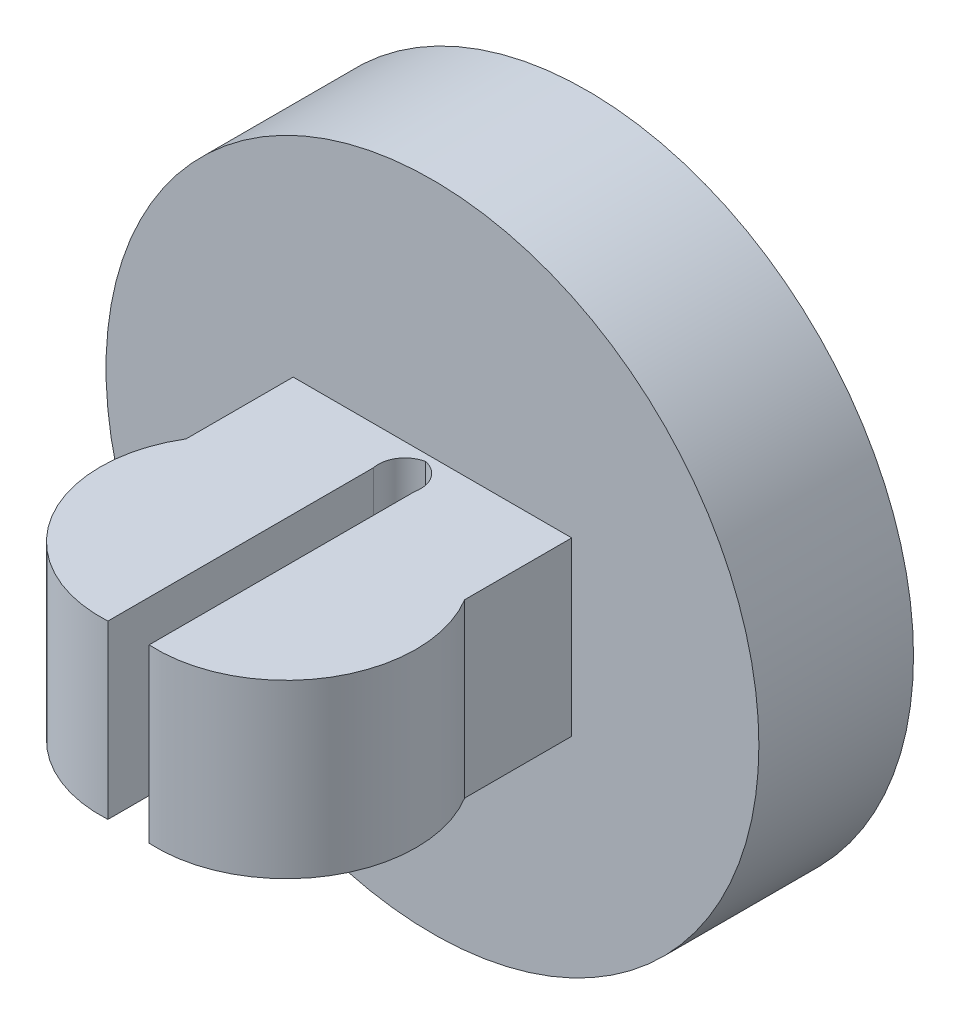
from build123d import *

# Parameters (mm, degrees)
SKETCH1_R           = 9.5
BOSS_EXTRUDE1_DEPTH = 4.5
BOSS_EXTRUDE2_DEPTH = 2.5


with BuildPart() as part:
    # Sketch1 → Boss-Extrude1 (new body)
    with BuildSketch(Plane.XY):
        Circle(SKETCH1_R)
    extrude(amount=BOSS_EXTRUDE1_DEPTH)

    # Sketch3 → Boss-Extrude2 (add, symmetric)
    with BuildSketch(Plane(origin=(0, 0, 0), x_dir=(1, 0, 0), z_dir=(0, 1, 0))):
        with BuildLine():
            Line((-4.053033857, -4.5), (4.053033857, -4.5))
            Line((4.053033857, -4.5), (4.053033857, -7.616562916))
            ThreePointArc((4.053033857, -7.616562916), (4.054677385, -11.522778367), (0.6, -13.345887254))
            Line((0.6, -13.345887254), (0.6, -5.620093755))
            ThreePointArc((0.6, -5.620093755), (0.490563802, -5.035767971), (0, -4.699970324))
            ThreePointArc((0, -4.699970324), (-0.490563802, -5.035767971), (-0.6, -5.620093755))
            Line((-0.6, -5.620093755), (-0.6, -13.345887254))
            ThreePointArc((-0.6, -13.345887254), (-4.054677385, -11.522778367), (-4.053033857, -7.616562916))
            Line((-4.053033857, -7.616562916), (-4.053033857, -4.5))
        make_face()
    extrude(amount=BOSS_EXTRUDE2_DEPTH, both=True)


solid = part.part
